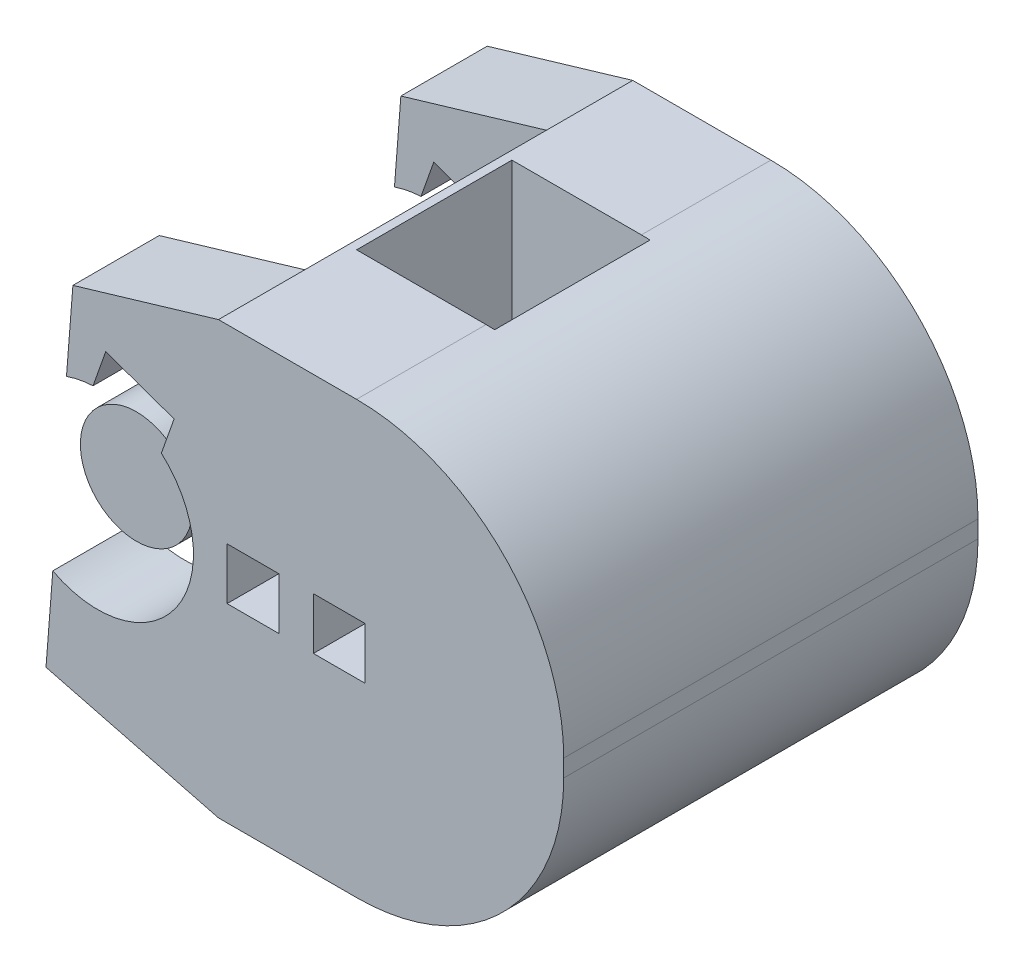
from build123d import *

# Parameters (mm, degrees)
SKETCH_1_R          = 3.25
EXTRUDE_1_DEPTH     = 19.5
SKETCH_2_W          = 14
SKETCH_2_H          = 15
EXTRUDE_2_DEPTH     = 2
EXTRUDE_3_DEPTH     = 14
FILLET_1_R          = 2
SKETCH_5_W          = 24
SKETCH_5_H          = 25
EXTRUDE_4_DEPTH     = 20
SKETCH_6_W          = 2.5
SKETCH_6_H          = 2.5
CUT_EXTRUDE_1_DEPTH = 40.298536868
SKETCH_7_W          = 3
SKETCH_7_H          = 3
CUT_EXTRUDE_2_DEPTH = 39.226299847
SKETCH_8_W          = 8
SKETCH_8_H          = 9
CUT_EXTRUDE_3_DEPTH = 43.744151647
SKETCH_9_W          = 2.5
SKETCH_9_H          = 2.5
EXTRUDE_5_DEPTH     = 11.5
FILLET_7_R          = 12
EXTRUDE_6_DEPTH     = 5
EXTRUDE_START       = -5
EXTRUDE_7_DEPTH     = 5


with BuildPart() as part:
    # ｽｹｯﾁ1 → ﾎﾞｽ - 押し出し1 (new body)
    with BuildSketch(Plane.XY):
        Circle(SKETCH_1_R)
    extrude(amount=EXTRUDE_1_DEPTH)



with BuildPart() as body_2:
    # ｽｹｯﾁ2 → ﾎﾞｽ - 押し出し2 (new body)
    with BuildSketch(Plane(origin=(5, 0, 0), x_dir=(0, 0, -1), z_dir=(1, 0, 0))):
        with Locations((-9.75, 0)):
            Rectangle(SKETCH_2_W, SKETCH_2_H)
    extrude(amount=EXTRUDE_2_DEPTH)


with BuildPart() as part_1:
    add(part.part)

    add(body_2.part)  # ﾎﾞｽ - 押し出し3 merges body 2
    # ｽｹｯﾁ3 → ﾎﾞｽ - 押し出し3 (add)
    with BuildSketch(Plane(origin=(0, 0, 2.75), x_dir=(-1, 0, 0), z_dir=(0, 0, -1))):
        Polygon((0, 0), (-5, 4.5), (-5, -4.5), align=None)
    extrude(amount=-EXTRUDE_3_DEPTH)

    # ﾌｨﾚｯﾄ1
    fillet_1_edges = [part_1.edges().sort_by_distance(p)[0] for p in [
        (2.415705975, 2.174135378, 9.75),
        (2.415705975, -2.174135378, 9.75),
        (5, 4.5, 9.75),
        (5, -4.5, 9.75),
    ]]
    fillet(fillet_1_edges, radius=FILLET_1_R)

    # ｽｹｯﾁ5 → ﾎﾞｽ - 押し出し4 (add)
    with BuildSketch(Plane(origin=(7, 0, 0), x_dir=(0, 0, -1), z_dir=(1, 0, 0))):
        with Locations((-9.75, 0)):
            Rectangle(SKETCH_5_W, SKETCH_5_H)
    extrude(amount=EXTRUDE_4_DEPTH)

    # ｽｹｯﾁ6 → ｶｯﾄ - 押し出し1 (cut, through all)
    with BuildSketch(Plane(origin=(27, 0, 0), x_dir=(0, 0, -1), z_dir=(1, 0, 0))):
        with Locations((-13, 0)):
            Rectangle(SKETCH_6_W, SKETCH_6_H)
        with Locations((-6.5, 0)):
            Rectangle(SKETCH_6_W, SKETCH_6_H)
    extrude(amount=-CUT_EXTRUDE_1_DEPTH, mode=Mode.SUBTRACT)

    # ｽｹｯﾁ7 → ｶｯﾄ - 押し出し2 (cut, through all)
    with BuildSketch(Plane.XY.offset(21.75)):
        with Locations((9, 0)):
            Rectangle(SKETCH_7_W, SKETCH_7_H)
        with Locations((14, 0)):
            Rectangle(SKETCH_7_W, SKETCH_7_H)
    extrude(amount=-CUT_EXTRUDE_2_DEPTH, mode=Mode.SUBTRACT)

    # ｽｹｯﾁ8 → ｶｯﾄ - 押し出し3 (cut, through all)
    with BuildSketch(Plane(origin=(0, 12.5, 0), x_dir=(1, 0, 0), z_dir=(0, 1, 0))):
        with Locations((11.5, -9.75)):
            Rectangle(SKETCH_8_W, SKETCH_8_H)
    extrude(amount=-CUT_EXTRUDE_3_DEPTH, mode=Mode.SUBTRACT)

    # ｽｹｯﾁ9 → ﾎﾞｽ - 押し出し5 (add)
    with BuildSketch(Plane.ZY.offset(-15.5)):
        with Locations((13, 0)):
            Rectangle(SKETCH_9_W, SKETCH_9_H)
        with Locations((6.5, 0)):
            Rectangle(SKETCH_9_W, SKETCH_9_H)
    extrude(amount=-EXTRUDE_5_DEPTH)

    # ﾌｨﾚｯﾄ7
    # the kernel refuses this fillet: 12 mm, written as the material it takes off along each edge
    with BuildSketch(Plane(origin=(27, -12.5, 51.75), x_dir=(-1, 0, 0), z_dir=(0, 0, -1))) as fillet_7_piece_1:
        with BuildLine():
            CenterArc((FILLET_7_R, FILLET_7_R), FILLET_7_R, 180, 90)
            Line((0, FILLET_7_R), (0, 0))
            Line((0, 0), (FILLET_7_R, 0))
        make_face()
    extrude(amount=84, mode=Mode.SUBTRACT)
    with BuildSketch(Plane(origin=(27, 12.5, -32.25), x_dir=(0, -1, 0), z_dir=(0, 0, 1))) as fillet_7_piece_2:
        with BuildLine():
            CenterArc((FILLET_7_R, -FILLET_7_R), FILLET_7_R, 90, 90)
            Line((0, -FILLET_7_R), (0, 0))
            Line((0, 0), (FILLET_7_R, 0))
        make_face()
    extrude(amount=84, mode=Mode.SUBTRACT)

    # ｽｹｯﾁ10 → ﾎﾞｽ - 押し出し6 (add)
    with BuildSketch(Plane(origin=(0, 0, 2.75), x_dir=(-1, 0, 0), z_dir=(0, 0, -1))):
        with BuildLine():
            Line((1.805058135, 5.248263058), (1.433861829, 10))
            Line((1.433861829, 10), (-7, 12.5))
            Line((-7, 12.5), (-7, -12.5))
            Line((-7, -12.5), (2.991476943, -9.939253626))
            Line((2.991476943, -9.939253626), (2.598155739, -4.904292687))
            ThreePointArc((2.598155739, -4.904292687), (-4.557007333, -3.167993713), (-3.692030902, 4.143839743))
            Line((-3.692030902, 4.143839743), (-4.42941418, 6.229991174))
            Line((-4.42941418, 6.229991174), (-0.469507268, 7.629683016))
            Line((-0.469507268, 7.629683016), (0.267876009, 5.543531586))
            ThreePointArc((0.267876009, 5.543531586), (1.046928779, 5.450361468), (1.805058135, 5.248263058))
        make_face()
    extrude(amount=EXTRUDE_6_DEPTH)

    # ｽｹｯﾁ11 → ﾎﾞｽ - 押し出し7 (add)
    with BuildSketch(Plane(origin=(0, 0, 16.75), x_dir=(-1, 0, 0), z_dir=(0, 0, -1)).offset(EXTRUDE_START)):
        with BuildLine():
            Line((1.805058135, 5.248263058), (1.433861829, 10))
            Line((1.433861829, 10), (-7, 12.5))
            Line((-7, 12.5), (-7, -12.5))
            Line((-7, -12.5), (2.991476943, -9.939253626))
            Line((2.991476943, -9.939253626), (2.598155739, -4.904292687))
            ThreePointArc((2.598155739, -4.904292687), (-4.557007333, -3.167993713), (-3.692030902, 4.143839743))
            Line((-3.692030902, 4.143839743), (-4.42941418, 6.229991174))
            Line((-4.42941418, 6.229991174), (-0.469507268, 7.629683016))
            Line((-0.469507268, 7.629683016), (0.267876009, 5.543531586))
            ThreePointArc((0.267876009, 5.543531586), (1.046928779, 5.450361468), (1.805058135, 5.248263058))
        make_face()
    extrude(amount=EXTRUDE_7_DEPTH)


solid = part_1.part
